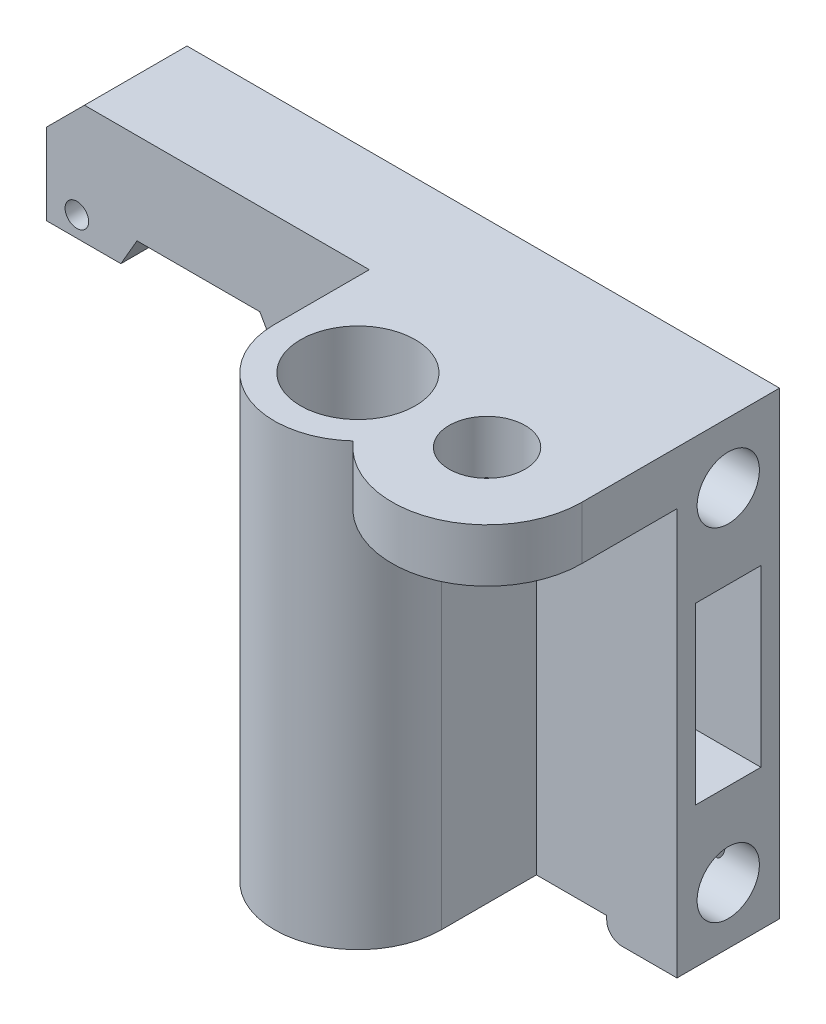
from build123d import *

# Parameters (mm, degrees)
CROQUIS1_R              = 7.55
CROQUIS1_R_2            = 5
SALIENTE_EXTRUIR1_DEPTH = 7
SALIENTE_EXTRUIR2_DEPTH = 51
SALIENTE_EXTRUIR3_START = 51
CROQUIS3_R              = 7.55
SALIENTE_EXTRUIR3_DEPTH = 51
CORTAR_EXTRUIR2_DEPTH   = 79.027238834
CROQUIS7_R              = 4.1
CORTAR_EXTRUIR3_DEPTH   = 35
CROQUIS8_W              = 8.6
CROQUIS8_H              = 23
CORTAR_EXTRUIR4_DEPTH   = 101.826583796
CROQUIS10_R             = 1.55
CORTAR_EXTRUIR7_DEPTH   = 79.027238834
CORTAR_EXTRUIR8_DEPTH   = 79.027238834
CROQUIS12_W             = 14.417096231
CROQUIS12_H             = 5
CORTAR_EXTRUIR9_DEPTH   = 79.027238834
CROQUIS13_W             = 9.25
CROQUIS13_H             = 13.5
SALIENTE_EXTRUIR4_DEPTH = 2.5
REDONDEO2_R             = 2
CROQUIS14_R             = 1
CORTAR_EXTRUIR10_DEPTH  = 8


with BuildPart() as part:
    # Croquis1 → Saliente-Extruir1 (new body)
    with BuildSketch(Plane(origin=(0, 0, 0), x_dir=(1, 0, 0), z_dir=(0, 1, 0))):
        with BuildLine():
            Line((-11, 0), (-11, 12.5))
            Line((-11, 12.5), (-53.5, 12.5))
            Line((-53.5, 12.5), (-53.5, 26))
            Line((-53.5, 26), (29.5, 26))
            Line((29.5, 26), (29.5, 8))
            Line((29.5, 8), (29.5, 0))
            ThreePointArc((29.5, 0), (21.303512587, -11.735833137), (7.463235294, -8.0808489))
            ThreePointArc((7.463235294, -8.0808489), (-4.410465495, -10.077092543), (-11, 0))
        make_face()
        Circle(CROQUIS1_R, mode=Mode.SUBTRACT)
        with Locations((17, 0)):
            Circle(CROQUIS1_R_2, mode=Mode.SUBTRACT)
    extrude(amount=SALIENTE_EXTRUIR1_DEPTH)

    # Croquis2 → Saliente-Extruir2 (add)
    with BuildSketch(Plane.XZ):
        Polygon((29.5, -26), (29.5, -12.5), (-11, -12.5), (-53.5, -12.5), (-53.5, -26), align=None)
    extrude(amount=SALIENTE_EXTRUIR2_DEPTH)

    # Croquis3 → Saliente-Extruir3 (add)
    with BuildSketch(Plane.XZ.offset(SALIENTE_EXTRUIR3_START)):
        with BuildLine():
            Line((-11, 0), (-11, -12.5))
            Line((-11, -12.5), (11, -12.5))
            Line((11, -12.5), (11, 0))
            ThreePointArc((11, 0), (10.077092543, 4.410465495), (7.463235294, 8.0808489))
            ThreePointArc((7.463235294, 8.0808489), (-4.410465495, 10.077092543), (-11, 0))
        make_face()
        Circle(CROQUIS3_R, mode=Mode.SUBTRACT)
    extrude(amount=-SALIENTE_EXTRUIR3_DEPTH)

    # Croquis5 → Cortar-Extruir2 (cut, through all)
    with BuildSketch(Plane.XY.offset(-12.5)):
        Polygon((-53.5, 7), (-48.5, 7), (-53.5, 2), align=None)
    extrude(amount=-CORTAR_EXTRUIR2_DEPTH, mode=Mode.SUBTRACT)

    # Croquis7 → Cortar-Extruir3 (cut)
    with BuildSketch(Plane(origin=(29.5, 0, 0), x_dir=(0, 0, -1), z_dir=(1, 0, 0))):
        with Locations((19.25, -1)):
            Circle(CROQUIS7_R)
        with Locations((19.25, -46)):
            Circle(CROQUIS7_R)
    extrude(amount=-CORTAR_EXTRUIR3_DEPTH, mode=Mode.SUBTRACT)

    # Croquis8 → Cortar-Extruir4 (cut, through all)
    with BuildSketch(Plane(origin=(29.5, 0, 0), x_dir=(0, 0, -1), z_dir=(1, 0, 0))):
        with Locations((19.25, -23.5)):
            Rectangle(CROQUIS8_W, CROQUIS8_H)
    extrude(amount=-CORTAR_EXTRUIR4_DEPTH, mode=Mode.SUBTRACT)

    # Croquis10 → Cortar-Extruir7 (cut, through all)
    with BuildSketch(Plane.XY.offset(-12.5)):
        with Locations((-49.5, -6)):
            Circle(CROQUIS10_R)
        with Locations((-18.5, -6)):
            Circle(CROQUIS10_R)
        with Locations((-18.5, -37)):
            Circle(CROQUIS10_R)
    extrude(amount=-CORTAR_EXTRUIR7_DEPTH, mode=Mode.SUBTRACT)

    # Croquis11 → Cortar-Extruir8 (cut, through all)
    with BuildSketch(Plane.XY.offset(-12.5)):
        Polygon((-43.7013662, -8.669284564), (-53.5, -8.669284564), (-53.5, -51), (-25.417096231, -51), (-25.417096231, -33), (-17.334192463, -19), (-25.417096231, -5), (-41.582903769, -5), align=None)
    extrude(amount=-CORTAR_EXTRUIR8_DEPTH, mode=Mode.SUBTRACT)

    # Croquis12 → Cortar-Extruir9 (cut, through all)
    with BuildSketch(Plane.XY.offset(-12.5)):
        with Locations((-18.208548116, -48.5)):
            Rectangle(CROQUIS12_W, CROQUIS12_H)
    extrude(amount=-CORTAR_EXTRUIR9_DEPTH, mode=Mode.SUBTRACT)

    # Croquis13 → Saliente-Extruir4 (add)
    with BuildSketch(Plane.XZ.offset(51)):
        with Locations((24.875, -19.25)):
            Rectangle(CROQUIS13_W, CROQUIS13_H)
    extrude(amount=SALIENTE_EXTRUIR4_DEPTH)

    # Redondeo2
    redondeo2_edges = [part.edges().sort_by_distance(p)[0] for p in [
        (20.25, -53.5, -19.25),
    ]]
    fillet(redondeo2_edges, radius=REDONDEO2_R)

    # Croquis14 → Cortar-Extruir10 (cut)
    with BuildSketch(Plane.XZ.offset(53.5)):
        with Locations((24.25, -14)):
            Circle(CROQUIS14_R)
        with Locations((24.25, -24)):
            Circle(CROQUIS14_R)
    extrude(amount=-CORTAR_EXTRUIR10_DEPTH, mode=Mode.SUBTRACT)


solid = part.part
